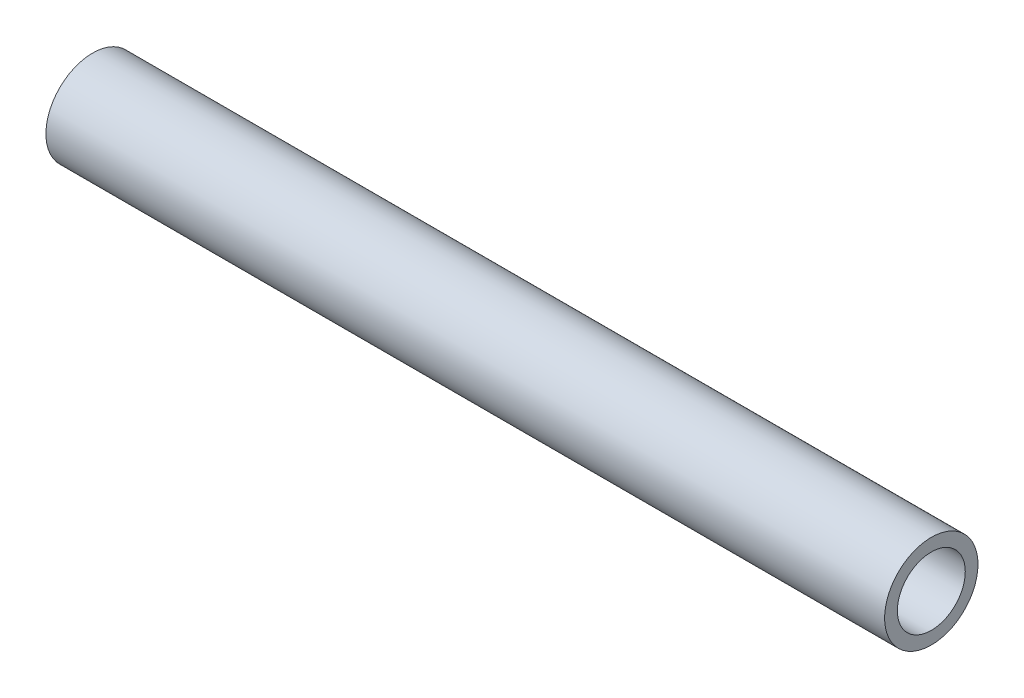
from build123d import *

# Parameters (mm, degrees)
CROQUIS1_R              = 16.7
CROQUIS1_R_2            = 12.15
SALIENTE_EXTRUIR1_DEPTH = 300


with BuildPart() as part:
    # Croquis1 → Saliente-Extruir1 (new body)
    with BuildSketch(Plane(origin=(0, 0, 0), x_dir=(0, 0, -1), z_dir=(1, 0, 0))):
        Circle(CROQUIS1_R)
        Circle(CROQUIS1_R_2, mode=Mode.SUBTRACT)
    extrude(amount=SALIENTE_EXTRUIR1_DEPTH)


solid = part.part
